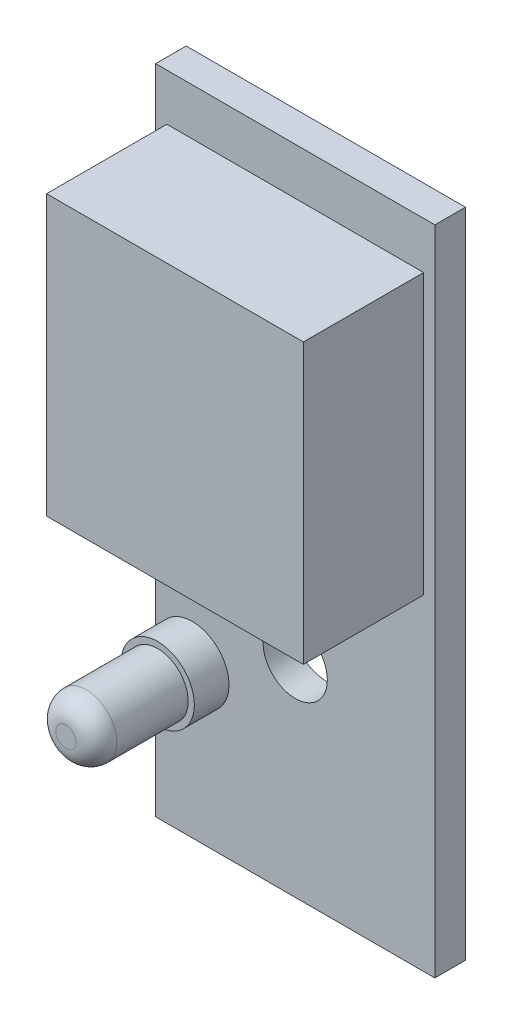
from build123d import *

# Parameters (mm, degrees)
SKETCH1_W           = 13.7
SKETCH1_H           = 32
BOSS_EXTRUDE1_DEPTH = 1.5
SKETCH2_W           = 12.6
SKETCH2_H           = 13.7
BOSS_EXTRUDE2_DEPTH = 5.9
SKETCH3_R           = 1.8
BOSS_EXTRUDE3_DEPTH = 1.7
SKETCH6_R           = 1.5
BOSS_EXTRUDE4_DEPTH = 4.5
FILLET1_R           = 1
SKETCH7_R           = 1.575
CUT_EXTRUDE1_DEPTH  = 19.475997943


with BuildPart() as part:
    # Sketch1 → Boss-Extrude1 (new body)
    with BuildSketch(Plane.XY):
        Rectangle(SKETCH1_W, SKETCH1_H)
    extrude(amount=BOSS_EXTRUDE1_DEPTH)

    # Sketch2 → Boss-Extrude2 (add)
    with BuildSketch(Plane.XY.offset(1.5)):
        with Locations((0, 6.85)):
            Rectangle(SKETCH2_W, SKETCH2_H)
    extrude(amount=BOSS_EXTRUDE2_DEPTH)

    # Sketch3 → Boss-Extrude3 (add)
    with BuildSketch(Plane.XY.offset(1.5)):
        with Locations((-5.05, -8.6)):
            Circle(SKETCH3_R)
    extrude(amount=BOSS_EXTRUDE3_DEPTH)

    # Sketch6 → Boss-Extrude4 (add)
    with BuildSketch(Plane.XY.offset(3.2)):
        with Locations((-5.05, -8.6)):
            Circle(SKETCH6_R)
    extrude(amount=BOSS_EXTRUDE4_DEPTH)

    # Fillet1
    fillet1_edges = [part.edges().sort_by_distance(p)[0] for p in [
        (-6.55, -8.6, 7.7),
    ]]
    fillet(fillet1_edges, radius=FILLET1_R)

    # Sketch7 → Cut-Extrude1 (cut, through all)
    with BuildSketch(Plane.XY.offset(1.5)):
        with Locations((0, -5.975)):
            Circle(SKETCH7_R)
    extrude(amount=-CUT_EXTRUDE1_DEPTH, mode=Mode.SUBTRACT)


solid = part.part
